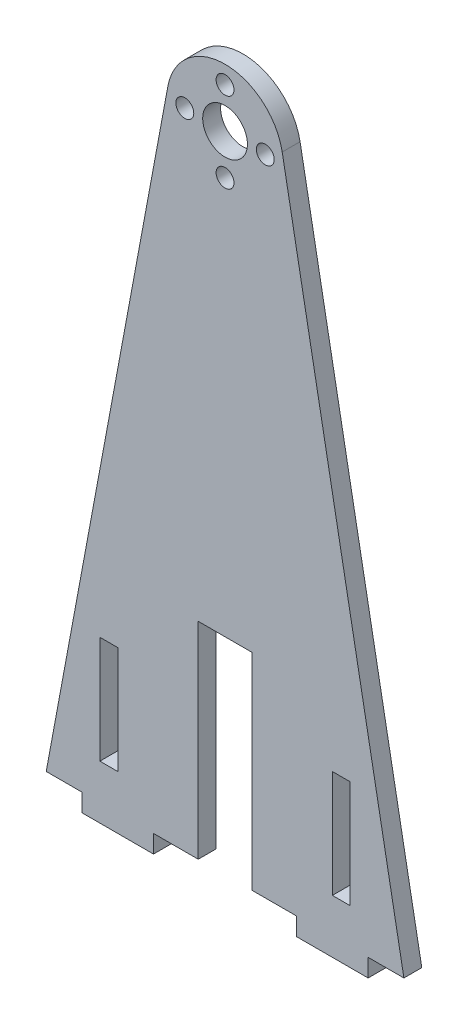
from build123d import *

# Parameters (mm, degrees)
SKETCH1_R           = 7.9375
SKETCH1_R_2         = 3.175
SKETCH1_W           = 6.35
SKETCH1_H           = 38.1
BOSS_EXTRUDE1_DEPTH = 6.35


with BuildPart() as part:
    # Sketch1 → Boss-Extrude1 (new body)
    with BuildSketch(Plane.XY):
        with BuildLine():
            Line((25.4, 0), (9.525, 0))
            Line((9.525, 0), (9.525, 73.166345412))
            Line((9.525, 73.166345412), (-9.525, 73.166345412))
            Line((-9.525, 73.166345412), (-9.525, 0))
            Line((-9.525, 0), (-25.4, 0))
            Line((-25.4, 0), (-25.4, -6.35))
            Line((-25.4, -6.35), (-50.8, -6.35))
            Line((-50.8, -6.35), (-50.8, 0))
            Line((-50.8, 0), (-63.5, 0))
            Line((-63.5, 0), (-20.289689544, 232.372917234))
            ThreePointArc((-20.289689544, 232.372917234), (0, 249.2375), (20.289689544, 232.372917234))
            Line((20.289689544, 232.372917234), (63.5, 0))
            Line((63.5, 0), (50.8, 0))
            Line((50.8, 0), (50.8, -6.35))
            Line((50.8, -6.35), (25.4, -6.35))
            Line((25.4, -6.35), (25.4, 0))
        make_face()
        with Locations((0, 228.6)):
            Circle(SKETCH1_R, mode=Mode.SUBTRACT)
        with Locations((0, 242.8875)):
            Circle(SKETCH1_R_2, mode=Mode.SUBTRACT)
        with Locations((14.2875, 228.6)):
            Circle(SKETCH1_R_2, mode=Mode.SUBTRACT)
        with Locations((0, 214.3125)):
            Circle(SKETCH1_R_2, mode=Mode.SUBTRACT)
        with Locations((-14.2875, 228.6)):
            Circle(SKETCH1_R_2, mode=Mode.SUBTRACT)
        with Locations((41.275, 31.75)):
            Rectangle(SKETCH1_W, SKETCH1_H, mode=Mode.SUBTRACT)
        with Locations((-41.275, 31.75)):
            Rectangle(SKETCH1_W, SKETCH1_H, mode=Mode.SUBTRACT)
    extrude(amount=BOSS_EXTRUDE1_DEPTH)


solid = part.part
